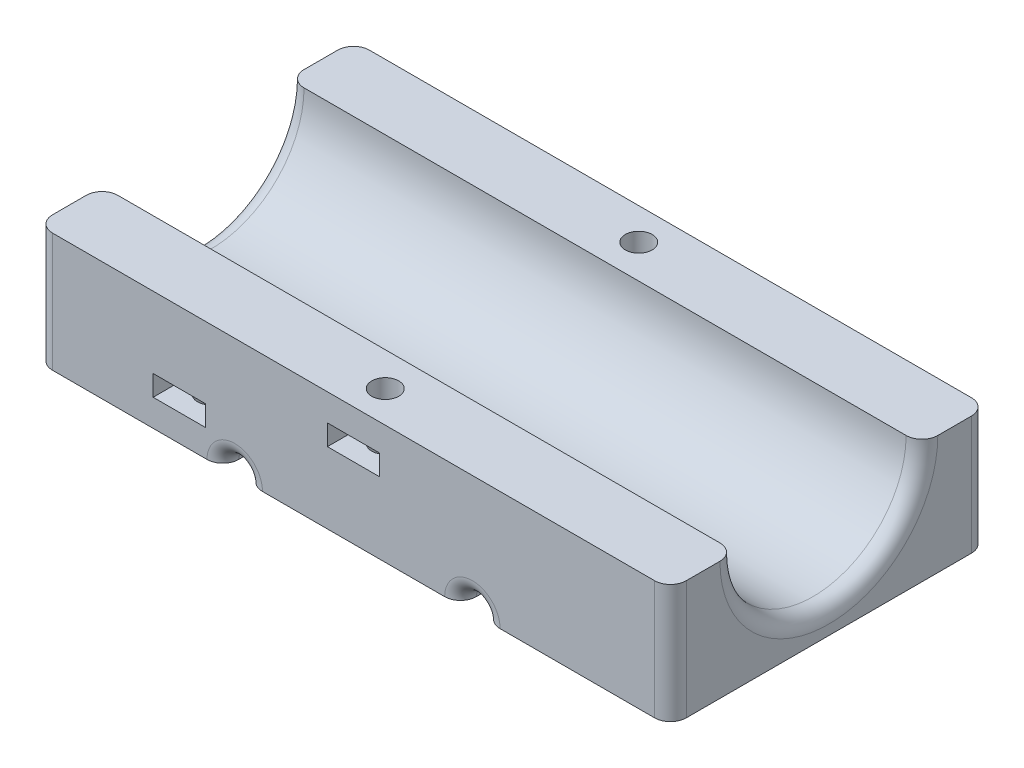
from build123d import *

# Parameters (mm, degrees)
BOSS_EXTRUDE2_DEPTH       = 101.6
SKETCH4_R                 = 1.905
CUT_EXTRUDE1_DEPTH        = 116.178567885
F_6_CLEARANCE_HOLE1_D     = 4.3053
F_6_CLEARANCE_HOLE1_DEPTH = 12.7
F_6_CLEARANCE_HOLE1_TIP   = 1.293442612
SKETCH8_W                 = 8.382
SKETCH8_H                 = 9.144
CUT_EXTRUDE2_DEPTH        = 3.302
F_6_CLEARANCE_HOLE2_D     = 4.3053
F_6_CLEARANCE_HOLE2_DEPTH = 12.7
F_6_CLEARANCE_HOLE2_TIP   = 1.293442612
SKETCH11_W                = 8.382
SKETCH11_H                = 9.144
CUT_EXTRUDE3_DEPTH        = 3.302
FILLET1_R                 = 2.54


with BuildPart() as part:
    # Sketch3 → Boss-Extrude2 (new body)
    with BuildSketch(Plane(origin=(0, 0, 0), x_dir=(0, 0, -1), z_dir=(1, 0, 0))):
        with BuildLine():
            Line((40.3225, 19.05), (50.8, 19.05))
            Line((50.8, 19.05), (50.8, 0))
            Line((50.8, 0), (0, 0))
            Line((0, 0), (0, 19.05))
            Line((0, 19.05), (10.4775, 19.05))
            ThreePointArc((10.4775, 19.05), (25.4, 4.1275), (40.3225, 19.05))
        make_face()
    extrude(amount=BOSS_EXTRUDE2_DEPTH)

    # Sketch4 → Cut-Extrude1 (cut, through all)
    with BuildSketch(Plane.XY):
        with Locations((31.75, 0)):
            Circle(SKETCH4_R)
        with Locations((69.85, 0)):
            Circle(SKETCH4_R)
    extrude(amount=-CUT_EXTRUDE1_DEPTH, mode=Mode.SUBTRACT)

    # #6 Clearance Hole1
    with Locations(Plane(origin=(0, 19.05, 0), x_dir=(1, 0, 0), z_dir=(0, 1, 0))):
        with Locations((50.8, 5.08), (50.8, 45.72)):
            Hole(F_6_CLEARANCE_HOLE1_D / 2, depth=F_6_CLEARANCE_HOLE1_DEPTH)
            with Locations((0, 0, -(F_6_CLEARANCE_HOLE1_DEPTH + F_6_CLEARANCE_HOLE1_TIP / 2))):  # 118° drill point
                Cone(0, F_6_CLEARANCE_HOLE1_D / 2, F_6_CLEARANCE_HOLE1_TIP, mode=Mode.SUBTRACT)

    # Sketch8 → Cut-Extrude2 (cut)
    with BuildSketch(Plane(origin=(0, 11.43, 0), x_dir=(1, 0, 0), z_dir=(0, 1, 0))):
        with Locations((50.8, 4.572)):
            Rectangle(SKETCH8_W, SKETCH8_H)
        with Locations((50.8, 46.228)):
            Rectangle(SKETCH8_W, SKETCH8_H)
    extrude(amount=CUT_EXTRUDE2_DEPTH, mode=Mode.SUBTRACT)

    # #6 Clearance Hole2
    with Locations(Plane(origin=(0, 0, 0), x_dir=(-1, 0, 0), z_dir=(0, -1, 0))):
        with Locations((-78.74, 45.72), (-22.86, 5.08)):
            Hole(F_6_CLEARANCE_HOLE2_D / 2, depth=F_6_CLEARANCE_HOLE2_DEPTH)
            with Locations((0, 0, -(F_6_CLEARANCE_HOLE2_DEPTH + F_6_CLEARANCE_HOLE2_TIP / 2))):  # 118° drill point
                Cone(0, F_6_CLEARANCE_HOLE2_D / 2, F_6_CLEARANCE_HOLE2_TIP, mode=Mode.SUBTRACT)

    # Sketch11 → Cut-Extrude3 (cut)
    with BuildSketch(Plane(origin=(0, 7.62, 0), x_dir=(-1, 0, 0), z_dir=(0, -1, 0))):
        with Locations((-78.74, 46.228)):
            Rectangle(SKETCH11_W, SKETCH11_H)
        with Locations((-22.86, 4.572)):
            Rectangle(SKETCH11_W, SKETCH11_H)
    extrude(amount=CUT_EXTRUDE3_DEPTH, mode=Mode.SUBTRACT)

    # Fillet1
    fillet1_edges = [part.edges().sort_by_distance(p)[0] for p in [
        (101.6, 4.1275, -25.4),
        (0, 4.1275, -25.4),
        (0, 9.525, -50.8),
        (101.6, 9.525, -50.8),
        (0, 9.525, 0),
        (101.6, 9.525, 0),
        (69.85, 1.905, -50.8),
        (69.85, 1.905, 0),
        (31.75, 1.905, -50.8),
        (31.75, 1.905, 0),
    ]]
    fillet(fillet1_edges, radius=FILLET1_R)


solid = part.part
